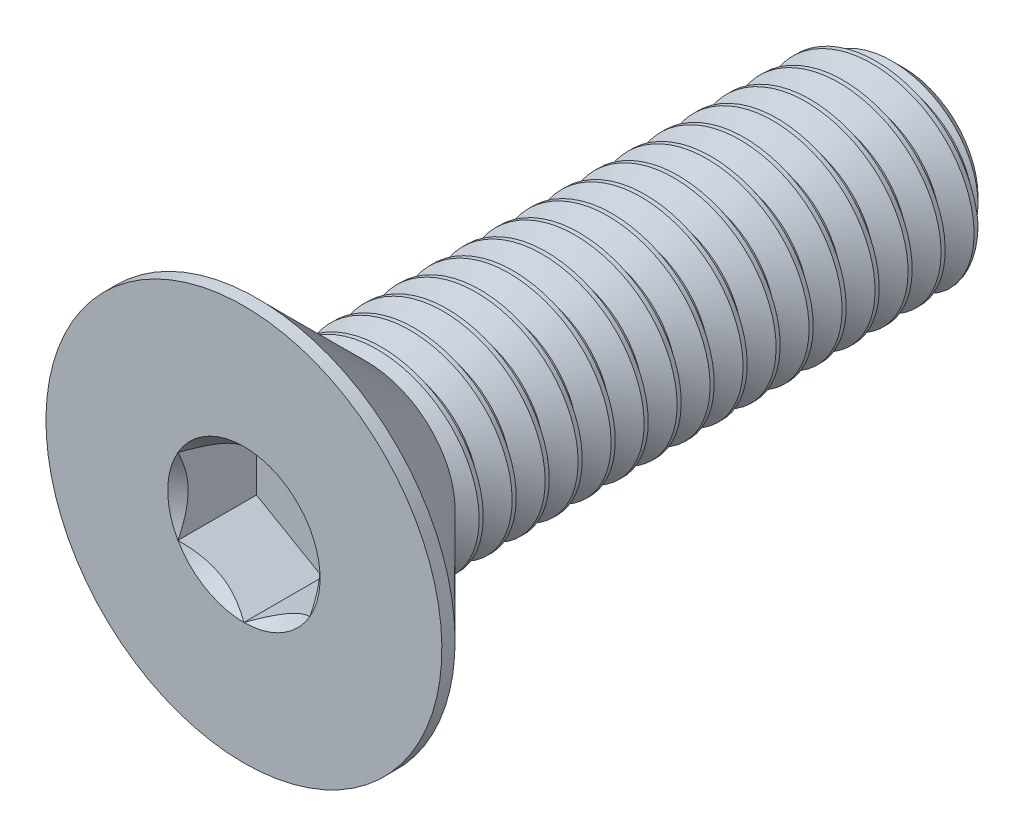
from build123d import *
from build123d.topology import SkipClean

# Parameters (mm, degrees)
SKETCH1_W          = 10
SKETCH1_H          = 1.5
CHAMFER1_SIZE      = 0.375
CUT_SWEEP1_PITCH   = 0.5
CUT_EXTRUDE2_DEPTH = 1.19


with BuildPart() as part:
    # Sketch1 → Revolve1 (revolve)
    with BuildSketch(Plane(origin=(0, 0, 0), x_dir=(0, 0, -1), z_dir=(1, 0, 0))):
        with Locations((5, 0.75)):
            Rectangle(SKETCH1_W, SKETCH1_H)
    revolve(axis=Axis((0, 0, -10), (0, 0, 1)))

    # Chamfer1
    chamfer1_edges = [part.edges().sort_by_distance(p)[0] for p in [
        (0, -1.5, -10),
    ]]
    chamfer(chamfer1_edges, length=CHAMFER1_SIZE)

    # Cut-Sweep1: arcs per turn and ends read off the stored shape
    # Cut-Sweep1: the profile of Sketch2 profile screwed along a right-hand helix through 21 turns, 6 arcs to a turn; built about Z, then put on its axis
    cut_sweep1_z = Axis((0, 0, 0), (0, 0, 1))
    cut_sweep1_corners = [(1.5006, 0, 0.00034641), (1.5006, 0, -0.43784641), (1.175240474, 0, -0.25), (1.175240474, 0, -0.1875)]
    with BuildLine(mode=Mode.PRIVATE) as cut_sweep1_profile:
        Line(cut_sweep1_corners[0], cut_sweep1_corners[1])
        Line(cut_sweep1_corners[1], cut_sweep1_corners[2])
        Line(cut_sweep1_corners[2], cut_sweep1_corners[3])
        Line(cut_sweep1_corners[3], cut_sweep1_corners[0])
    cut_sweep1_cap = Face(cut_sweep1_profile.wire())
    cut_sweep1_turn_angles = [0, 30, 60, 90, 120, 150, 180, 210, 240, 270, 300, 330, 360]
    cut_sweep1_turn_weights = [1, 0.8660254037844387, 1, 0.8660254037844387, 1, 0.8660254037844387, 1, 0.8660254037844387, 1, 0.8660254037844387, 1, 0.8660254037844387, 1]
    cut_sweep1_turn_rails = [Edge.make_bspline([Vector(p[0], p[1], 0).rotate(cut_sweep1_z, cut_sweep1_turn_angles[k]) / cut_sweep1_turn_weights[k] + Vector(0, 0, p[2] + CUT_SWEEP1_PITCH * cut_sweep1_turn_angles[k] / 360) for k in range(13)], [0, 0, 0, 1, 1, 2, 2, 3, 3, 4, 4, 5, 5, 6, 6, 6], 2, cut_sweep1_turn_weights) for p in cut_sweep1_corners]
    cut_sweep1_turn_sides = [Face.make_surface_from_curves(cut_sweep1_turn_rails[p[0]], cut_sweep1_turn_rails[p[1]]) for p in [(0, 1), (1, 2), (2, 3), (3, 0)]]
    cut_sweep1 = Plane(origin=(0, 0, -10), x_dir=(0, 1, 0), z_dir=(0, 0, 1)) * Solid(Shell([*[p.moved(Location((0, 0, CUT_SWEEP1_PITCH * i))) for i in range(21) for p in cut_sweep1_turn_sides], cut_sweep1_cap, cut_sweep1_cap.rotate(cut_sweep1_z, 7560).moved(Location((0, 0, CUT_SWEEP1_PITCH * 7560 / 360)))]))
    add(cut_sweep1, mode=Mode.SUBTRACT)

    # Sketch7 → Revolve2 (revolve)
    with BuildSketch(Plane(origin=(0, 0, 0), x_dir=(0, 0, -1), z_dir=(1, 0, 0)), mode=Mode.PRIVATE) as revolve2_sk:
        Polygon((0, 3), (0.2, 3), (1.7, 1.5), (1.7, 0), (0, 0), align=None)
    revolve(revolve2_sk.sketch.rotate(Axis((0, 0, 0), (0, 0, -1)), 180), axis=Axis((0, 0, 0), (0, 0, -1)))

    # Boss-Extrude1 cone 1 section (through the dimple's axis) → Boss-Extrude1 (revolve)
    with SkipClean():  # the faces are left unmerged after this step: merging them gives an invalid solid
        with BuildSketch(Plane(origin=(0, 0, -1.7), x_dir=(0, -1, 0), z_dir=(1, 0, 0))):
            Polygon((0, 0), (1.5, 0), (0, 1.5), align=None)
        revolve(axis=Axis((0, 0, -1.7), (0, 0, -1)))

    # Sketch5 → Cut-Extrude2 (cut)
    with SkipClean():  # the faces are left unmerged after this step: merging them gives an invalid solid
        with BuildSketch(Plane.XY):
            Polygon((1, -0.577350269), (1, 0.577350269), (0, 1.154700538), (-1, 0.577350269), (-1, -0.577350269), (0, -1.154700538), align=None)
        extrude(amount=-CUT_EXTRUDE2_DEPTH, mode=Mode.SUBTRACT)

    # Cut-Extrude3 cone 1 section (through the dimple's axis) → Cut-Extrude3 (revolve, cut)
    with SkipClean():  # the faces are left unmerged after this step: merging them gives an invalid solid
        with BuildSketch(Plane(origin=(0, 0, 0), x_dir=(0, -1, 0), z_dir=(1, 0, 0))):
            Polygon((0, 0), (1.154700538, 0), (0, 1.154700538), align=None)
        revolve(axis=Axis((0, 0, 0), (0, 0, -1)), mode=Mode.SUBTRACT)


solid = part.part
